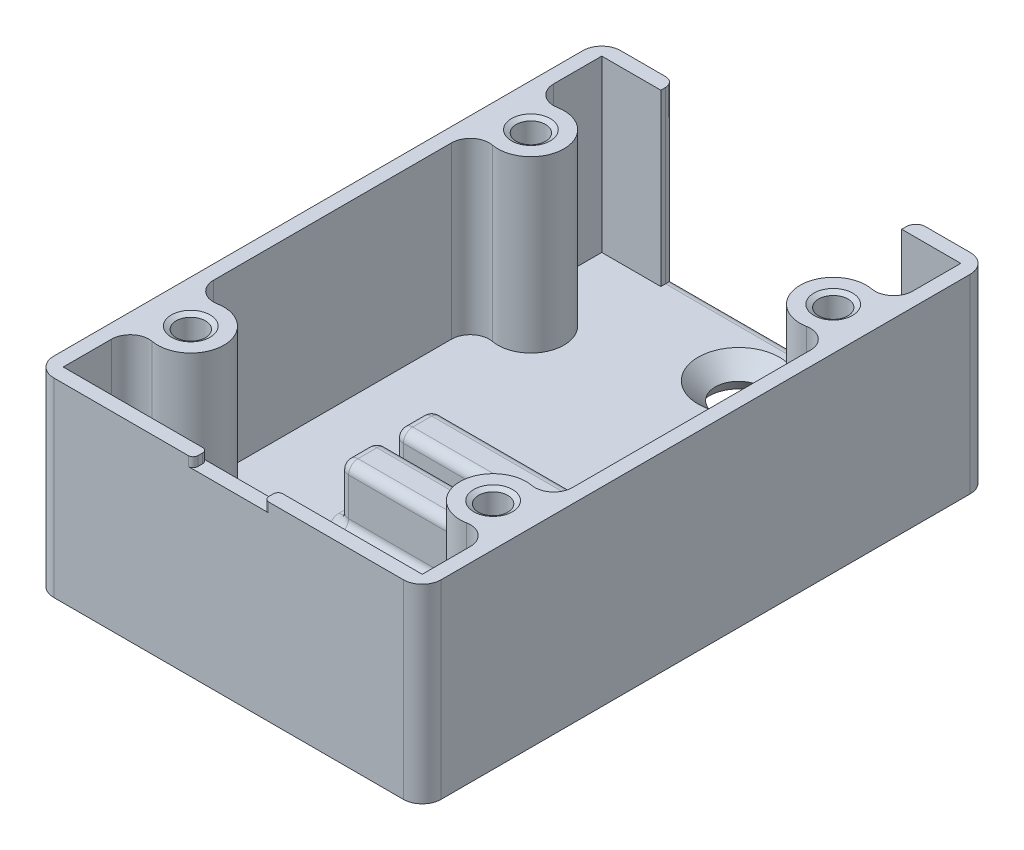
from build123d import *
from OCP.BRepFilletAPI import BRepFilletAPI_MakeChamfer

# Parameters (mm, degrees)
SKETCH_1_W          = 41
SKETCH_1_H          = 60
SKETCH_1_R          = 2.3
EXTRUDE_1_DEPTH     = 3
CHAMFER_1_SIZE      = 2
SKETCH_2_W          = 41
SKETCH_2_H          = 60
SKETCH_2_W_2        = 38
SKETCH_2_H_2        = 57
EXTRUDE_1_2_DEPTH   = 18
SKETCH_3_W          = 25.5
SKETCH_3_H          = 3.030341357
CUT_EXTRUDE_1_DEPTH = 18
SKETCH_4_R          = 3.5
EXTRUDE_2_DEPTH     = 18
SKETCH_5_R          = 1.55
CUT_EXTRUDE_2_DEPTH = 10
SKETCH_6_W          = 16
SKETCH_6_H          = 4
EXTRUDE_3_DEPTH     = 6
SKETCH_7_W          = 7.5
SKETCH_7_H          = 4.667229269
CUT_EXTRUDE_3_DEPTH = 1
FILLET_2_R          = 0.5
FILLET_3_R          = 2
CHAMFER_4_SIZE      = 0.866025404
CHAMFER_4_SIZE_2    = 1.5
FILLET_4_R          = 1
CHAMFER_6_SIZE      = 0.5
CHAMFER_6_SIZE2     = 0.288675135
FILLET_5_R          = 1
FILLET_7_R          = 2


with BuildPart() as part:
    # Эскиз1 → Extrude 1 (new body)
    with BuildSketch(Plane(origin=(0, 0, 0), x_dir=(1, 0, 0), z_dir=(0, 1, 0))):
        Rectangle(SKETCH_1_W, SKETCH_1_H)
        with Locations(Location((0, 24, 0), (0, 0, 270))):
            Circle(SKETCH_1_R, mode=Mode.SUBTRACT)
        with Locations(Location((0, -24, 0), (0, 0, 270))):
            Circle(SKETCH_1_R, mode=Mode.SUBTRACT)
    extrude(amount=EXTRUDE_1_DEPTH)

    # Фаска1
    chamfer_1_edges = [part.edges().sort_by_distance(p)[0] for p in [
        (0, 3, -26.3),
        (0, 3, 21.7),
    ]]
    chamfer(chamfer_1_edges, length=CHAMFER_1_SIZE)

    # Эскиз2 → Extrude 1 2 (add)
    with BuildSketch(Plane(origin=(0, 3, 0), x_dir=(1, 0, 0), z_dir=(0, 1, 0))):
        Rectangle(SKETCH_2_W, SKETCH_2_H)
        Rectangle(SKETCH_2_W_2, SKETCH_2_H_2, mode=Mode.SUBTRACT)
    extrude(amount=EXTRUDE_1_2_DEPTH)

    # Эскиз3 → Вырез-Вытянуть1 (cut)
    with BuildSketch(Plane(origin=(0, 21, 0), x_dir=(1, 0, 0), z_dir=(0, 1, 0))):
        with Locations((0, 29.478101209)):
            Rectangle(SKETCH_3_W, SKETCH_3_H)
    extrude(amount=-CUT_EXTRUDE_1_DEPTH, mode=Mode.SUBTRACT)

    # Эскиз4 → Бобышка-Вытянуть2 (add)
    with BuildSketch(Plane(origin=(0, 3, 0), x_dir=(1, 0, 0), z_dir=(0, 1, 0))):
        with Locations((16, 18)):
            Circle(SKETCH_4_R)
        with Locations((-16, 18)):
            Circle(SKETCH_4_R)
        with Locations((16, -18)):
            Circle(SKETCH_4_R)
        with Locations((-16, -18)):
            Circle(SKETCH_4_R)
    extrude(amount=EXTRUDE_2_DEPTH)

    # Эскиз5 → Вырез-Вытянуть2 (cut)
    with BuildSketch(Plane(origin=(0, 21, 0), x_dir=(1, 0, 0), z_dir=(0, 1, 0))):
        with Locations(Location((16, 18, 0), (0, 0, 270))):
            Circle(SKETCH_5_R)
        with Locations(Location((16, -18, 0), (0, 0, 270))):
            Circle(SKETCH_5_R)
        with Locations(Location((-16, -18, 0), (0, 0, 270))):
            Circle(SKETCH_5_R)
        with Locations(Location((-16, 18, 0), (0, 0, 270))):
            Circle(SKETCH_5_R)
    extrude(amount=-CUT_EXTRUDE_2_DEPTH, mode=Mode.SUBTRACT)

    # Эскиз6 → Бобышка-Вытянуть3 (add)
    with BuildSketch(Plane(origin=(0, 3, 0), x_dir=(1, 0, 0), z_dir=(0, 1, 0))):
        with Locations((0, -2.5)):
            Rectangle(SKETCH_6_W, SKETCH_6_H)
        with Locations((0, -8.3)):
            Rectangle(SKETCH_6_W, SKETCH_6_H)
    extrude(amount=EXTRUDE_3_DEPTH)

    # Эскиз7 → Вырез-Вытянуть3 (cut)
    with BuildSketch(Plane(origin=(0, 21, 0), x_dir=(1, 0, 0), z_dir=(0, 1, 0))):
        with Locations((0, -28.649225697)):
            Rectangle(SKETCH_7_W, SKETCH_7_H)
    extrude(amount=-CUT_EXTRUDE_3_DEPTH, mode=Mode.SUBTRACT)

    # Скругление2
    fillet_2_edges = [part.edges().sort_by_distance(p)[0] for p in [
        (-3.75, 20.5, 28.5),
        (3.75, 20.5, 28.5),
        (3.75, 20.5, 30),
        (-3.75, 20.5, 30),
    ]]
    fillet(fillet_2_edges, radius=FILLET_2_R)

    # Скругление3
    fillet_3_edges = [part.edges().sort_by_distance(p)[0] for p in [
        (20.5, 10.5, 30),
        (-20.5, 10.5, 30),
        (-20.5, 10.5, -30),
        (20.5, 10.5, -30),
    ]]
    fillet(fillet_3_edges, radius=FILLET_3_R)

    # Фаска4
    # the kernel refuses this chamfer: 1.5, 0.866025404 mm, written as the material it takes off along each edge
    with BuildSketch(Plane(origin=(0, 0, 24), x_dir=(0, 0, 1), z_dir=(-1, 0, 0))) as chamfer_4_piece_1:
        Polygon((2.3 + CHAMFER_4_SIZE, 0), (2.3, CHAMFER_4_SIZE_2), (2.3, 0), align=None)
    revolve(axis=Axis((0, 0, 24), (0, 1, 0)), mode=Mode.SUBTRACT)
    with BuildSketch(Plane(origin=(18.5, 0, -30), x_dir=(0, -0.01932676561270073, 0.999813220622208), z_dir=(-1, 0, 0))) as chamfer_4_piece_2:
        Polygon((CHAMFER_4_SIZE_2 * 0.999813220622, CHAMFER_4_SIZE_2 * 0.0193267656127), (-CHAMFER_4_SIZE * 0.0193267656079, CHAMFER_4_SIZE * 0.999813220373), (0, 0), align=None)
    extrude(amount=37, mode=Mode.SUBTRACT)
    with BuildSketch(Plane(origin=(-20.5, 0, -28), x_dir=(0.999813220622208, -0.01932676561270073, 0), z_dir=(0, 0, 1)), Plane(origin=(20.5, 0, 28), x_dir=(-0.999813220622208, -0.01932676561270073, 0), z_dir=(0, 0, -1))) as chamfer_4_piece_3:
        Polygon((CHAMFER_4_SIZE_2 * 0.999813220622, CHAMFER_4_SIZE_2 * 0.0193267656127), (-CHAMFER_4_SIZE * 0.0193267656079, CHAMFER_4_SIZE * 0.999813220373), (0, 0), align=None)
    extrude(amount=56, mode=Mode.SUBTRACT)
    with BuildSketch(Plane(origin=(-18.5, 0, 30), x_dir=(0, 0.9983227437537924, 0.0578938624026721), z_dir=(1, 0, 0))) as chamfer_4_piece_4:
        Polygon((CHAMFER_4_SIZE * 0.998322743505, -CHAMFER_4_SIZE * 0.0578938623883), (-CHAMFER_4_SIZE_2 * 0.0578938624027, -CHAMFER_4_SIZE_2 * 0.998322743754), (0, 0), align=None)
    extrude(amount=37, mode=Mode.SUBTRACT)
    with BuildSketch(Plane(origin=(-18.5, 0, -28), x_dir=(0, 0, -1), z_dir=(1, 0, 0))) as chamfer_4_piece_5:
        Polygon((2 - CHAMFER_4_SIZE_2, 0), (2, CHAMFER_4_SIZE), (2, 0), align=None)
    revolve(axis=Axis((-18.5, 0, -28), (0, 1, 0)), revolution_arc=90, mode=Mode.SUBTRACT)
    with BuildSketch(Plane(origin=(-18.5, 0, 28), x_dir=(0, 0, 1), z_dir=(1, 0, 0))) as chamfer_4_piece_6:
        Polygon((2 - CHAMFER_4_SIZE_2, 0), (2, -CHAMFER_4_SIZE), (2, 0), align=None)
    revolve(axis=Axis((-18.5, 0, 28), (0, -1, 0)), revolution_arc=90, mode=Mode.SUBTRACT)
    with BuildSketch(Plane(origin=(18.5, 0, 28), x_dir=(0, 0, 1), z_dir=(-1, 0, 0))) as chamfer_4_piece_7:
        Polygon((2, CHAMFER_4_SIZE), (2 - CHAMFER_4_SIZE_2, 0), (2, 0), align=None)
    revolve(axis=Axis((18.5, 0, 28), (0, 1, 0)), revolution_arc=90, mode=Mode.SUBTRACT)
    with BuildSketch(Plane(origin=(18.5, 0, -28), x_dir=(0, 0, -1), z_dir=(-1, 0, 0))) as chamfer_4_piece_8:
        Polygon((2 - CHAMFER_4_SIZE_2, 0), (2, -CHAMFER_4_SIZE), (2, 0), align=None)
    revolve(axis=Axis((18.5, 0, -28), (0, -1, 0)), revolution_arc=90, mode=Mode.SUBTRACT)
    with BuildSketch(Plane(origin=(0, 0, -24), x_dir=(0, 0, 1), z_dir=(-1, 0, 0))) as chamfer_4_piece_9:
        Polygon((2.3 + CHAMFER_4_SIZE, 0), (2.3, CHAMFER_4_SIZE_2), (2.3, 0), align=None)
    revolve(axis=Axis((0, 0, -24), (0, 1, 0)), mode=Mode.SUBTRACT)

    # Скругление4
    # the kernel refuses this fillet: 1 mm, written as the material it takes off along each edge
    with BuildSketch(Plane(origin=(-7, 8, 1.5), x_dir=(0, 0, -1), z_dir=(-1, 0, 0))) as fillet_4_piece_1_section:
        Polygon((0, 0), (FILLET_4_R, 0), (FILLET_4_R, -FILLET_4_R), (0, -FILLET_4_R), align=None)
    fillet_4_piece_1 = extrude(amount=FILLET_4_R, mode=Mode.PRIVATE)
    fillet_4_piece_1 = fillet_4_piece_1 - Plane(origin=(-7, 8, 1.5), x_dir=(0, -0.7071067811865475, 0.7071067811865475), z_dir=(-1, 0, 0)) * Sphere(FILLET_4_R, mode=Mode.PRIVATE)
    add(fillet_4_piece_1, mode=Mode.SUBTRACT)
    with BuildSketch(Plane(origin=(-7, 8, 3.5), x_dir=(0, 0, 1), z_dir=(-1, 0, 0))) as fillet_4_piece_2_section:
        Polygon((0, 0), (FILLET_4_R, 0), (FILLET_4_R, FILLET_4_R), (0, FILLET_4_R), align=None)
    fillet_4_piece_2 = extrude(amount=FILLET_4_R, mode=Mode.PRIVATE)
    fillet_4_piece_2 = fillet_4_piece_2 - Plane(origin=(-7, 8, 3.5), x_dir=(0, -0.7071067811865475, -0.7071067811865475), z_dir=(-1, 0, 0)) * Sphere(FILLET_4_R, mode=Mode.PRIVATE)
    add(fillet_4_piece_2, mode=Mode.SUBTRACT)
    with BuildSketch(Plane(origin=(7, 8, 3.5), x_dir=(1, 0, 0), z_dir=(0, 0, 1))) as fillet_4_piece_3_section:
        Polygon((0, 0), (FILLET_4_R, 0), (FILLET_4_R, FILLET_4_R), (0, FILLET_4_R), align=None)
    fillet_4_piece_3 = extrude(amount=FILLET_4_R, mode=Mode.PRIVATE)
    fillet_4_piece_3 = fillet_4_piece_3 - Plane(origin=(7, 8, 3.5), x_dir=(-0.7071067811865475, -0.7071067811865475, 0), z_dir=(0, 0, 1)) * Sphere(FILLET_4_R, mode=Mode.PRIVATE)
    add(fillet_4_piece_3, mode=Mode.SUBTRACT)
    with BuildSketch(Plane(origin=(7, 8, 1.5), x_dir=(0, 0, -1), z_dir=(1, 0, 0))) as fillet_4_piece_4_section:
        Polygon((0, 0), (FILLET_4_R, 0), (FILLET_4_R, FILLET_4_R), (0, FILLET_4_R), align=None)
    fillet_4_piece_4 = extrude(amount=FILLET_4_R, mode=Mode.PRIVATE)
    fillet_4_piece_4 = fillet_4_piece_4 - Plane(origin=(7, 8, 1.5), x_dir=(0, -0.7071067811865475, 0.7071067811865475), z_dir=(1, 0, 0)) * Sphere(FILLET_4_R, mode=Mode.PRIVATE)
    add(fillet_4_piece_4, mode=Mode.SUBTRACT)
    with BuildSketch(Plane(origin=(-7, 8, 7.3), x_dir=(-1, 0, 0), z_dir=(0, 0, -1))) as fillet_4_piece_5_section:
        Polygon((0, 0), (FILLET_4_R, 0), (FILLET_4_R, FILLET_4_R), (0, FILLET_4_R), align=None)
    fillet_4_piece_5 = extrude(amount=FILLET_4_R, mode=Mode.PRIVATE)
    fillet_4_piece_5 = fillet_4_piece_5 - Plane(origin=(-7, 8, 7.3), x_dir=(0.7071067811865475, -0.7071067811865475, 0), z_dir=(0, 0, -1)) * Sphere(FILLET_4_R, mode=Mode.PRIVATE)
    add(fillet_4_piece_5, mode=Mode.SUBTRACT)
    with BuildSketch(Plane(origin=(-7, 8, 9.3), x_dir=(-1, 0, 0), z_dir=(0, 1, 0))) as fillet_4_piece_6_section:
        Polygon((0, 0), (FILLET_4_R, 0), (FILLET_4_R, FILLET_4_R), (0, FILLET_4_R), align=None)
    fillet_4_piece_6 = extrude(amount=FILLET_4_R, mode=Mode.PRIVATE)
    fillet_4_piece_6 = fillet_4_piece_6 - Plane(origin=(-7, 8, 9.3), x_dir=(0.7071067811865475, 0, -0.7071067811865475), z_dir=(0, 1, 0)) * Sphere(FILLET_4_R, mode=Mode.PRIVATE)
    add(fillet_4_piece_6, mode=Mode.SUBTRACT)
    with BuildSketch(Plane(origin=(7, 8, 9.3), x_dir=(0, 0, 1), z_dir=(0, 1, 0))) as fillet_4_piece_7_section:
        Polygon((0, 0), (FILLET_4_R, 0), (FILLET_4_R, FILLET_4_R), (0, FILLET_4_R), align=None)
    fillet_4_piece_7 = extrude(amount=FILLET_4_R, mode=Mode.PRIVATE)
    fillet_4_piece_7 = fillet_4_piece_7 - Plane(origin=(7, 8, 9.3), x_dir=(-0.7071067811865475, 0, -0.7071067811865475), z_dir=(0, 1, 0)) * Sphere(FILLET_4_R, mode=Mode.PRIVATE)
    add(fillet_4_piece_7, mode=Mode.SUBTRACT)
    with BuildSketch(Plane(origin=(7, 8, 7.3), x_dir=(0, 1, 0), z_dir=(0, 0, -1))) as fillet_4_piece_8_section:
        Polygon((0, 0), (FILLET_4_R, 0), (FILLET_4_R, FILLET_4_R), (0, FILLET_4_R), align=None)
    fillet_4_piece_8 = extrude(amount=FILLET_4_R, mode=Mode.PRIVATE)
    fillet_4_piece_8 = fillet_4_piece_8 - Plane(origin=(7, 8, 7.3), x_dir=(-0.7071067811865475, -0.7071067811865475, 0), z_dir=(0, 0, -1)) * Sphere(FILLET_4_R, mode=Mode.PRIVATE)
    add(fillet_4_piece_8, mode=Mode.SUBTRACT)
    with BuildSketch(Plane(origin=(-8, 3, 0.5), x_dir=(0, 0, 1), z_dir=(0, 1, 0)), Plane(origin=(-8, 3, 6.3), x_dir=(0, 0, 1), z_dir=(0, 1, 0))) as fillet_4_piece_9:
        with BuildLine():
            CenterArc((FILLET_4_R, FILLET_4_R), FILLET_4_R, 180, 90)
            Line((0, FILLET_4_R), (0, 0))
            Line((0, 0), (FILLET_4_R, 0))
        make_face()
    extrude(amount=5, mode=Mode.SUBTRACT)
    with BuildSketch(Plane(origin=(-8, 3, 4.5), x_dir=(0, 0, -1), z_dir=(0, 1, 0)), Plane(origin=(8, 3, 4.5), x_dir=(-1, 0, 0), z_dir=(0, 1, 0)), Plane(origin=(8, 3, 0.5), x_dir=(0, 0, 1), z_dir=(0, 1, 0)), Plane(origin=(-8, 3, 10.3), x_dir=(0, 0, -1), z_dir=(0, 1, 0)), Plane(origin=(8, 3, 10.3), x_dir=(-1, 0, 0), z_dir=(0, 1, 0)), Plane(origin=(8, 3, 6.3), x_dir=(0, 0, 1), z_dir=(0, 1, 0))) as fillet_4_piece_10:
        with BuildLine():
            CenterArc((FILLET_4_R, -FILLET_4_R), FILLET_4_R, 90, 90)
            Line((0, -FILLET_4_R), (0, 0))
            Line((0, 0), (FILLET_4_R, 0))
        make_face()
    extrude(amount=5, mode=Mode.SUBTRACT)
    with BuildSketch(Plane(origin=(-8, 9, 3.5), x_dir=(0, -1, 0), z_dir=(0, 0, -1)), Plane(origin=(8, 9, 1.5), x_dir=(0, -1, 0), z_dir=(0, 0, 1)), Plane(origin=(-8, 9, 9.3), x_dir=(0, -1, 0), z_dir=(0, 0, -1)), Plane(origin=(8, 9, 7.3), x_dir=(0, -1, 0), z_dir=(0, 0, 1))) as fillet_4_piece_11:
        with BuildLine():
            CenterArc((FILLET_4_R, -FILLET_4_R), FILLET_4_R, 90, 90)
            Line((0, -FILLET_4_R), (0, 0))
            Line((0, 0), (FILLET_4_R, 0))
        make_face()
    extrude(amount=2, mode=Mode.SUBTRACT)
    with BuildSketch(Plane(origin=(7, 9, 4.5), x_dir=(0, -1, 0), z_dir=(-1, 0, 0)), Plane(origin=(-7, 9, 0.5), x_dir=(0, -1, 0), z_dir=(1, 0, 0)), Plane(origin=(7, 9, 10.3), x_dir=(0, -1, 0), z_dir=(-1, 0, 0)), Plane(origin=(-7, 9, 6.3), x_dir=(0, -1, 0), z_dir=(1, 0, 0))) as fillet_4_piece_12:
        with BuildLine():
            CenterArc((FILLET_4_R, -FILLET_4_R), FILLET_4_R, 90, 90)
            Line((0, -FILLET_4_R), (0, 0))
            Line((0, 0), (FILLET_4_R, 0))
        make_face()
    extrude(amount=14, mode=Mode.SUBTRACT)
    # the kernel refuses this fillet: 1 mm, written as the material it adds along each edge
    with BuildSketch(Plane(origin=(-8, 3, 3.5), x_dir=(-1, 0, 0), z_dir=(0, 0, -1)), Plane(origin=(8, 3, 1.5), x_dir=(1, 0, 0), z_dir=(0, 0, 1)), Plane(origin=(-8, 3, 9.3), x_dir=(-1, 0, 0), z_dir=(0, 0, -1)), Plane(origin=(8, 3, 7.3), x_dir=(1, 0, 0), z_dir=(0, 0, 1))) as fillet_4_2_piece_1:
        with BuildLine():
            CenterArc((FILLET_4_R, FILLET_4_R), FILLET_4_R, 180, 90)
            Line((0, FILLET_4_R), (0, 0))
            Line((0, 0), (FILLET_4_R, 0))
        make_face()
    extrude(amount=2)
    with BuildSketch(Plane(origin=(7, 3, 4.5), x_dir=(0, 0, 1), z_dir=(-1, 0, 0)), Plane(origin=(-7, 3, 0.5), x_dir=(0, 0, -1), z_dir=(1, 0, 0)), Plane(origin=(7, 3, 10.3), x_dir=(0, 0, 1), z_dir=(-1, 0, 0)), Plane(origin=(-7, 3, 6.3), x_dir=(0, 0, -1), z_dir=(1, 0, 0))) as fillet_4_2_piece_2:
        with BuildLine():
            CenterArc((FILLET_4_R, FILLET_4_R), FILLET_4_R, 180, 90)
            Line((0, FILLET_4_R), (0, 0))
            Line((0, 0), (FILLET_4_R, 0))
        make_face()
    extrude(amount=14)
    with BuildSketch(Plane(origin=(-7, 3, 7.3), x_dir=(-1, 0, 0), z_dir=(0, 0, 1))) as fillet_4_2_piece_3:
        with BuildLine():
            CenterArc((1 + FILLET_4_R, -FILLET_4_R), FILLET_4_R, 90, 90)
            Line((1, -FILLET_4_R), (1, 0))
            Line((1, 0), (1 + FILLET_4_R, 0))
        make_face()
    revolve(axis=Axis((-7, 3, 7.3), (0, -1, 0)), revolution_arc=90)
    with BuildSketch(Plane(origin=(7, 3, 7.3), x_dir=(1, 0, 0), z_dir=(0, 0, 1))) as fillet_4_2_piece_4:
        with BuildLine():
            CenterArc((1 + FILLET_4_R, FILLET_4_R), FILLET_4_R, 180, 90)
            Line((1, FILLET_4_R), (1, 0))
            Line((1, 0), (1 + FILLET_4_R, 0))
        make_face()
    revolve(axis=Axis((7, 3, 7.3), (0, 1, 0)), revolution_arc=90)
    with BuildSketch(Plane(origin=(7, 3, 9.3), x_dir=(0, 0, 1), z_dir=(-1, 0, 0))) as fillet_4_2_piece_5:
        with BuildLine():
            CenterArc((1 + FILLET_4_R, FILLET_4_R), FILLET_4_R, 180, 90)
            Line((1, FILLET_4_R), (1, 0))
            Line((1, 0), (1 + FILLET_4_R, 0))
        make_face()
    revolve(axis=Axis((7, 3, 9.3), (0, 1, 0)), revolution_arc=90)
    with BuildSketch(Plane(origin=(-7, 3, 9.3), x_dir=(-1, 0, 0), z_dir=(0, 0, -1))) as fillet_4_2_piece_6:
        with BuildLine():
            CenterArc((1 + FILLET_4_R, FILLET_4_R), FILLET_4_R, 180, 90)
            Line((1, FILLET_4_R), (1, 0))
            Line((1, 0), (1 + FILLET_4_R, 0))
        make_face()
    revolve(axis=Axis((-7, 3, 9.3), (0, 1, 0)), revolution_arc=90)
    with BuildSketch(Plane(origin=(-7, 3, 1.5), x_dir=(-1, 0, 0), z_dir=(0, 0, 1))) as fillet_4_2_piece_7:
        with BuildLine():
            CenterArc((1 + FILLET_4_R, -FILLET_4_R), FILLET_4_R, 90, 90)
            Line((1, -FILLET_4_R), (1, 0))
            Line((1, 0), (1 + FILLET_4_R, 0))
        make_face()
    revolve(axis=Axis((-7, 3, 1.5), (0, -1, 0)), revolution_arc=90)
    with BuildSketch(Plane(origin=(7, 3, 1.5), x_dir=(1, 0, 0), z_dir=(0, 0, 1))) as fillet_4_2_piece_8:
        with BuildLine():
            CenterArc((1 + FILLET_4_R, FILLET_4_R), FILLET_4_R, 180, 90)
            Line((1, FILLET_4_R), (1, 0))
            Line((1, 0), (1 + FILLET_4_R, 0))
        make_face()
    revolve(axis=Axis((7, 3, 1.5), (0, 1, 0)), revolution_arc=90)
    with BuildSketch(Plane(origin=(7, 3, 3.5), x_dir=(0, 0, 1), z_dir=(-1, 0, 0))) as fillet_4_2_piece_9:
        with BuildLine():
            CenterArc((1 + FILLET_4_R, FILLET_4_R), FILLET_4_R, 180, 90)
            Line((1, FILLET_4_R), (1, 0))
            Line((1, 0), (1 + FILLET_4_R, 0))
        make_face()
    revolve(axis=Axis((7, 3, 3.5), (0, 1, 0)), revolution_arc=90)
    with BuildSketch(Plane(origin=(-7, 3, 3.5), x_dir=(-1, 0, 0), z_dir=(0, 0, -1))) as fillet_4_2_piece_10:
        with BuildLine():
            CenterArc((1 + FILLET_4_R, FILLET_4_R), FILLET_4_R, 180, 90)
            Line((1, FILLET_4_R), (1, 0))
            Line((1, 0), (1 + FILLET_4_R, 0))
        make_face()
    revolve(axis=Axis((-7, 3, 3.5), (0, 1, 0)), revolution_arc=90)

    # Фаска6: one chamfer whose edges measure the first distance from different faces: ONE call of the kernel's chamfer builder (chamfer() names one face for all edges)
    chamfer_6_edges_1 = [part.edges().sort_by_distance(p)[0] for p in [
        (-16, 21, -19.55),
        (-16, 21, 16.45),
    ]]
    chamfer_6_side_1 = [part.faces().sort_by_distance(p)[0] for p in [
        (-11.375, 21, 29.37705839),
    ]]
    chamfer_6_edges_2 = [part.edges().sort_by_distance(p)[0] for p in [
        (16, 21, 16.45),
        (16, 21, -19.55),
    ]]
    chamfer_6_side_2 = [part.faces().sort_by_distance(p)[0] for p in [
        (11.375, 21, 29.37705839),
    ]]
    chamfer_6 = BRepFilletAPI_MakeChamfer(part.part.solid().wrapped)
    for e in chamfer_6_edges_1:
        chamfer_6.Add(CHAMFER_6_SIZE, CHAMFER_6_SIZE2, e.wrapped, chamfer_6_side_1[0].wrapped)  # the first distance lies on this face
    for e in chamfer_6_edges_2:
        chamfer_6.Add(CHAMFER_6_SIZE, CHAMFER_6_SIZE2, e.wrapped, chamfer_6_side_2[0].wrapped)  # the first distance lies on this face
    add(Compound.cast(chamfer_6.Shape()), mode=Mode.REPLACE)

    # Скругление5
    fillet_5_edges = [part.edges().sort_by_distance(p)[0] for p in [
        (0, 3, -30),
        (-12.75, 12, -30),
        (12.75, 12, -30),
    ]]
    fillet(fillet_5_edges, radius=FILLET_5_R)

    # Скругление7
    fillet_7_edges = [part.edges().sort_by_distance(p)[0] for p in [
        (19, 12, 16.197224362),
        (19, 12, 19.802775638),
        (-19, 12, 19.802775638),
        (-19, 12, 16.197224362),
        (19, 12, -16.197224362),
        (19, 12, -19.802775638),
        (-19, 12, -19.802775638),
        (-19, 12, -16.197224362),
    ]]
    fillet(fillet_7_edges, radius=FILLET_7_R)


solid = part.part
